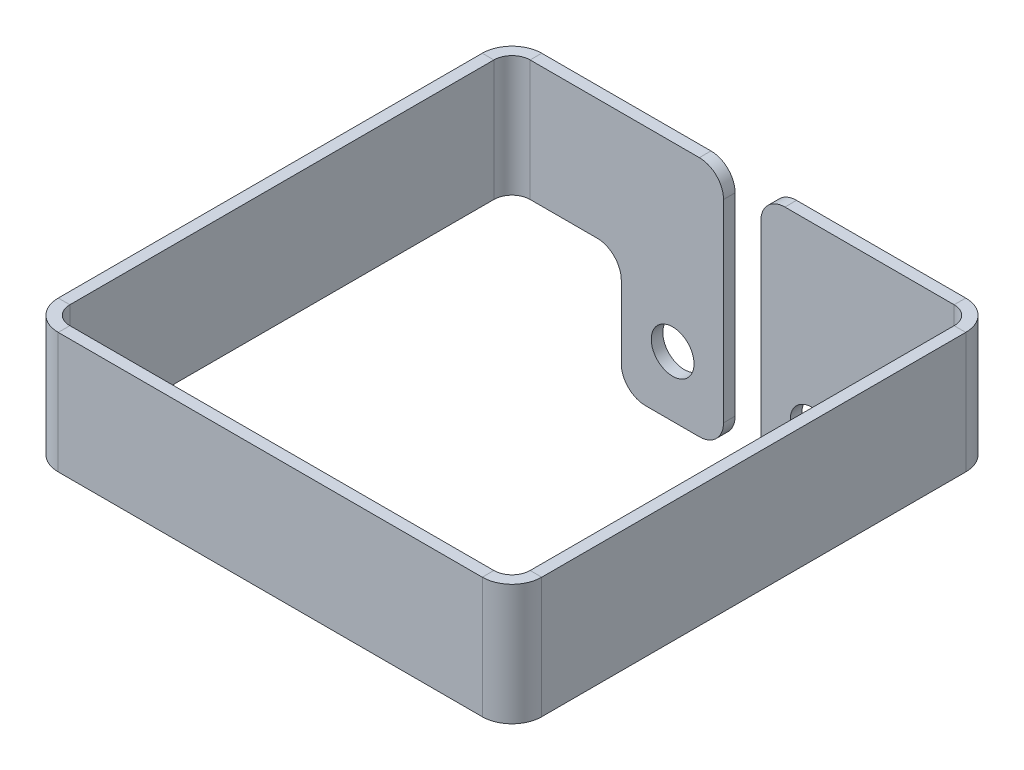
from build123d import *

# Parameters (mm, degrees)
SKETCH1_W                      = 50.8
SKETCH1_H                      = 1.2192
BASE_FLANGE1_DEPTH             = 12.7
EDGE_FLANGE1_STRIP_W           = 8.6868
EDGE_FLANGE1_STRIP_H           = 1.2192
EDGE_FLANGE1_STRIP_CUT_DEPTH   = 12.7
EDGE_FLANGE1_STRIP_2_W         = 8.6868
EDGE_FLANGE1_STRIP_2_H         = 1.2192
EDGE_FLANGE1_STRIP_CUT_2_DEPTH = 12.7
EDGE_FLANGE1_DEPTH             = 12.7
EDGE_FLANGE1_BEND_DEPTH        = 12.7
EDGE_FLANGE2_STRIP_W           = 8.6868
EDGE_FLANGE2_STRIP_H           = 1.2192
EDGE_FLANGE2_STRIP_CUT_DEPTH   = 12.7
EDGE_FLANGE2_DEPTH             = 12.7
EDGE_FLANGE3_STRIP_W           = 8.6868
EDGE_FLANGE3_STRIP_H           = 1.2192
EDGE_FLANGE3_STRIP_CUT_DEPTH   = 12.7
EDGE_FLANGE3_DEPTH             = 12.7
SKETCH18_W                     = 10.7442
SKETCH18_H                     = 12.7
BOSS_EXTRUDE1_DEPTH            = 1.2192
FILLET1_R                      = 2.54
F_8_CLEARANCE_HOLE1_D          = 4.4958


# Sheet-metal steps are written as plain solids
with BuildPart() as part:
    # Sketch1 → Base-Flange1 (new body)
    with BuildSketch(Plane(origin=(0, 0, 0), x_dir=(1, 0, 0), z_dir=(0, 1, 0))):
        with Locations((25.4, -0.6096)):
            Rectangle(SKETCH1_W, SKETCH1_H)
    extrude(amount=BASE_FLANGE1_DEPTH)

    # Edge-Flange1 strip (across the edge) → Edge-Flange1 strip cut (cut)
    with BuildSketch(Plane(origin=(50.8, 12.7, 0), x_dir=(-1, 0, 0), z_dir=(0, -1, 0))):
        with Locations((-1.2192, -0.6096)):
            Rectangle(EDGE_FLANGE1_STRIP_W, EDGE_FLANGE1_STRIP_H)
    extrude(amount=EDGE_FLANGE1_STRIP_CUT_DEPTH, mode=Mode.SUBTRACT)

    # Edge-Flange1 strip 2 (across the edge) → Edge-Flange1 strip cut 2 (cut)
    with BuildSketch(Plane(origin=(0, 0, 0), x_dir=(1, 0, 0), z_dir=(0, 1, 0))):
        with Locations((-1.2192, -0.6096)):
            Rectangle(EDGE_FLANGE1_STRIP_2_W, EDGE_FLANGE1_STRIP_2_H)
    extrude(amount=EDGE_FLANGE1_STRIP_CUT_2_DEPTH, mode=Mode.SUBTRACT)

    # Edge-Flange1 section (across the edge) → Edge-Flange1 (add)
    with BuildSketch(Plane(origin=(50.8, 12.7, 0), x_dir=(-1, 0, 0), z_dir=(0, -1, 0))):
        with BuildLine():
            Line((0, 1.905), (0, 49.5808))
            Line((0, 49.5808), (1.2192, 49.5808))
            Line((1.2192, 49.5808), (1.2192, 1.905))
            ThreePointArc((1.2192, 1.905), (1.777161582, 0.557961582), (3.1242, 0))
            Line((3.1242, 0), (3.1242, -1.2192))
            ThreePointArc((3.1242, -1.2192), (0.915056994, -0.304143006), (0, 1.905))
        make_face()
    extrude(amount=EDGE_FLANGE1_DEPTH)

    # Edge-Flange1 section 2 (across the edge) → Edge-Flange1 bend (add)
    with BuildSketch(Plane(origin=(0, 0, 0), x_dir=(1, 0, 0), z_dir=(0, 1, 0))):
        with BuildLine():
            Line((0, 1.905), (0, 49.5808))
            Line((0, 49.5808), (1.2192, 49.5808))
            Line((1.2192, 49.5808), (1.2192, 1.905))
            ThreePointArc((1.2192, 1.905), (1.777161582, 0.557961582), (3.1242, 0))
            Line((3.1242, 0), (3.1242, -1.2192))
            ThreePointArc((3.1242, -1.2192), (0.915056994, -0.304143006), (0, 1.905))
        make_face()
    extrude(amount=EDGE_FLANGE1_BEND_DEPTH)

    # Edge-Flange2 strip (across the edge) → Edge-Flange2 strip cut (cut)
    with BuildSketch(Plane(origin=(49.5808, 12.7, -49.5808), x_dir=(0, 0, 1), z_dir=(0, -1, 0))):
        with Locations((-1.2192, -0.6096)):
            Rectangle(EDGE_FLANGE2_STRIP_W, EDGE_FLANGE2_STRIP_H)
    extrude(amount=EDGE_FLANGE2_STRIP_CUT_DEPTH, mode=Mode.SUBTRACT)

    # Edge-Flange2 section (across the edge) → Edge-Flange2 (add)
    with BuildSketch(Plane(origin=(49.5808, 12.7, -49.5808), x_dir=(0, 0, 1), z_dir=(0, -1, 0))):
        with BuildLine():
            Line((0, 1.905), (0, 22.225))
            Line((0, 22.225), (1.2192, 22.225))
            Line((1.2192, 22.225), (1.2192, 1.905))
            ThreePointArc((1.2192, 1.905), (1.777161582, 0.557961582), (3.1242, 0))
            Line((3.1242, 0), (3.1242, -1.2192))
            ThreePointArc((3.1242, -1.2192), (0.915056994, -0.304143006), (0, 1.905))
        make_face()
    extrude(amount=EDGE_FLANGE2_DEPTH)

    # Edge-Flange3 strip (across the edge) → Edge-Flange3 strip cut (cut)
    with BuildSketch(Plane(origin=(1.2192, 0, -49.5808), x_dir=(0, 0, 1), z_dir=(0, 1, 0))):
        with Locations((-1.2192, -0.6096)):
            Rectangle(EDGE_FLANGE3_STRIP_W, EDGE_FLANGE3_STRIP_H)
    extrude(amount=EDGE_FLANGE3_STRIP_CUT_DEPTH, mode=Mode.SUBTRACT)

    # Edge-Flange3 section (across the edge) → Edge-Flange3 (add)
    with BuildSketch(Plane(origin=(1.2192, 0, -49.5808), x_dir=(0, 0, 1), z_dir=(0, 1, 0))):
        with BuildLine():
            Line((0, 1.905), (0, 22.225))
            Line((0, 22.225), (1.2192, 22.225))
            Line((1.2192, 22.225), (1.2192, 1.905))
            ThreePointArc((1.2192, 1.905), (1.777161582, 0.557961582), (3.1242, 0))
            Line((3.1242, 0), (3.1242, -1.2192))
            ThreePointArc((3.1242, -1.2192), (0.915056994, -0.304143006), (0, 1.905))
        make_face()
    extrude(amount=EDGE_FLANGE3_DEPTH)

    # Sketch18 → Boss-Extrude1 (add)
    with BuildSketch(Plane.XY.offset(-48.3616)):
        with Locations((18.0721, -6.35)):
            Rectangle(SKETCH18_W, SKETCH18_H)
        with Locations((32.7279, -6.35)):
            Rectangle(SKETCH18_W, SKETCH18_H)
    extrude(amount=-BOSS_EXTRUDE1_DEPTH)

    # Fillet1
    fillet1_edges = [part.edges().sort_by_distance(p)[0] for p in [
        (23.4442, 12.7, -48.9712),
        (12.7, 0, -48.9712),
        (12.7, -12.7, -48.9712),
        (23.4442, -12.7, -48.9712),
        (38.1, -12.7, -48.9712),
        (38.1, 0, -48.9712),
        (27.3558, -12.7, -48.9712),
        (27.3558, 12.7, -48.9712),
    ]]
    fillet(fillet1_edges, radius=FILLET1_R)

    # #8 Clearance Hole1 (through all)
    with Locations(Plane.XY.offset(-48.3616)):
        with Locations((18.0975, -6.35), (32.7025, -6.35)):
            Hole(F_8_CLEARANCE_HOLE1_D / 2)


solid = part.part
